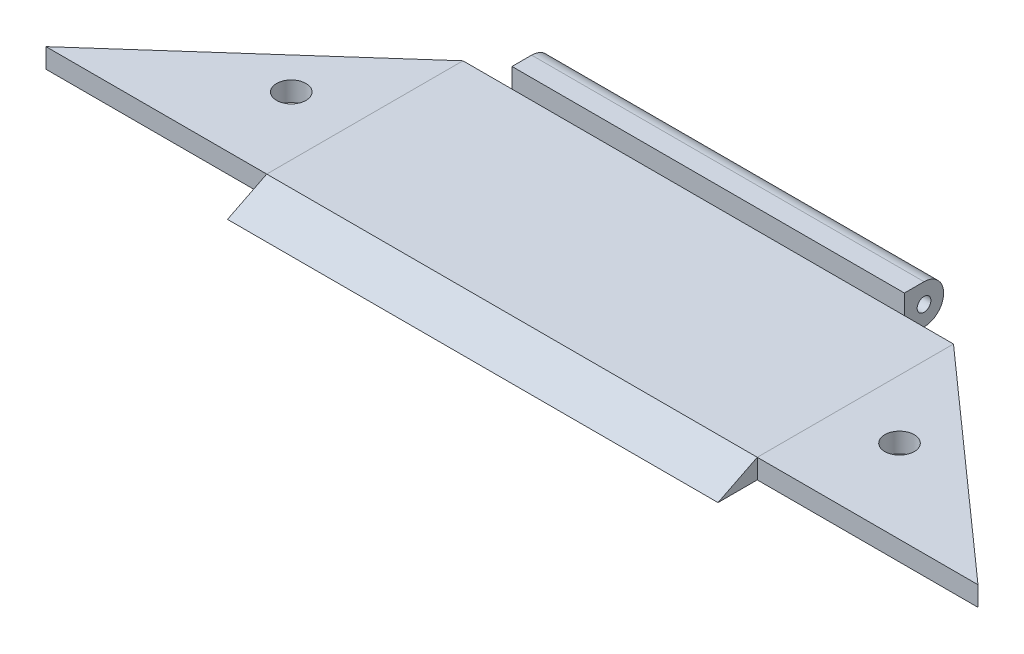
from build123d import *

# Parameters (mm, degrees)
SKETCH_1_R          = 7
EXTRUDE_1_DEPTH     = 500
SKETCH_2_W          = 50
SKETCH_2_H          = 40
CUT_EXTRUDE_1_DEPTH = 500
SKETCH_3_R          = 15
EXTRUDE_2_DEPTH     = 20
EXTRUDE_2_2_DEPTH   = 20
FILLET_2_R          = 20


with BuildPart() as part:
    # 草图1 → 凸台-拉伸1 (new body)
    # profile 1 of 2: a face of its own
    with BuildSketch(Plane(origin=(0, 0, 0), x_dir=(0, 0, -1), z_dir=(1, 0, 0))):
        Polygon((152.934492446, 20), (152.934492446, 0), (192.934492446, 0), (192.934492446, 40), (152.934492446, 40), align=None)
        with Locations((172.934492446, 20)):
            Circle(SKETCH_1_R, mode=Mode.SUBTRACT)
    # profile 2 of 2: a face of its own
    with BuildSketch(Plane(origin=(0, 0, 0), x_dir=(0, 0, -1), z_dir=(1, 0, 0))):
        Polygon((152.934492446, 20), (-47.065507554, 20), (-87.065507554, 0), (152.934492446, 0), align=None)
    extrude(amount=EXTRUDE_1_DEPTH)

    # 草图2 → 切除-拉伸1 (cut)
    with BuildSketch(Plane(origin=(0, 40, 0), x_dir=(1, 0, 0), z_dir=(0, 1, 0))):
        with Locations((25, 172.934492446)):
            Rectangle(SKETCH_2_W, SKETCH_2_H)
        with Locations((475, 172.934492446)):
            Rectangle(SKETCH_2_W, SKETCH_2_H)
    extrude(amount=-CUT_EXTRUDE_1_DEPTH, mode=Mode.SUBTRACT)

    # 圆角2
    fillet_2_edges = [part.edges().sort_by_distance(p)[0] for p in [
        (250, 0, -192.934492446),
        (250, 40, -192.934492446),
    ]]
    fillet(fillet_2_edges, radius=FILLET_2_R - 0.0001)  # a hair under: the kernel refuses the full size


with BuildPart() as body_2:
    # 草图3 → 凸台-拉伸2 (new body)
    with BuildSketch(Plane(origin=(0, 20, 0), x_dir=(1, 0, 0), z_dir=(0, 1, 0))):
        Polygon((500, 152.934492446), (500, -47.065507554), (725, -47.065507554), align=None)
        with Locations(Location((560, 37.934492446, 0), (0, 0, 270))):
            Circle(SKETCH_3_R, mode=Mode.SUBTRACT)
    extrude(amount=-EXTRUDE_2_DEPTH)


with BuildPart() as body_3:
    # 草图3 → Extrude 2 2 (new body)
    with BuildSketch(Plane(origin=(0, 20, 0), x_dir=(1, 0, 0), z_dir=(0, 1, 0))):
        Polygon((-225, -47.065507554), (0, -47.065507554), (0, 152.934492446), align=None)
        with Locations(Location((-60, 37.934492446, 0), (0, 0, 270))):
            Circle(SKETCH_3_R, mode=Mode.SUBTRACT)
    extrude(amount=-EXTRUDE_2_2_DEPTH)


solid = Compound([part.part, body_2.part, body_3.part])
